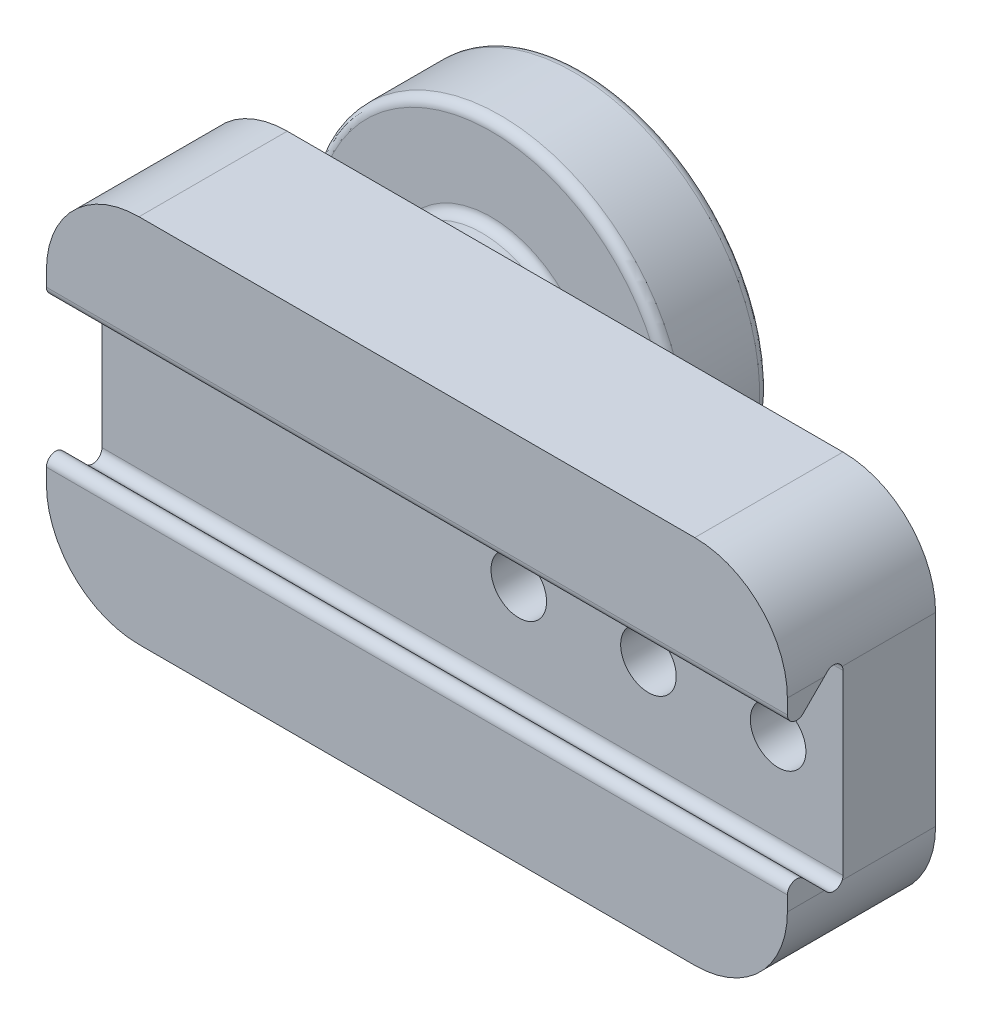
from build123d import *

# Parameters (mm, degrees)
BOSS_EXTRUDE1_DEPTH = 5
SKETCH2_R           = 5
BOSS_EXTRUDE2_DEPTH = 11
BOSS_EXTRUDE3_DEPTH = 8
CUT_EXTRUDE1_DEPTH  = 42
SKETCH6_R           = 1.5
CUT_EXTRUDE2_DEPTH  = 32
LPATTERN1_COUNT     = 3
LPATTERN1_PITCH     = 7
FILLET1_R           = 0.5
FILLET2_R           = 5
FILLET3_R           = 0.5


with BuildPart() as part:
    # Sketch1 → Boss-Extrude1 (new body)
    with BuildSketch(Plane.XY):
        with BuildLine():
            ThreePointArc((10, 0), (0, 10), (-10, 0))
            ThreePointArc((-10, 0), (0, -10), (10, 0))
        make_face()
    extrude(amount=BOSS_EXTRUDE1_DEPTH)

    # Sketch2 → Boss-Extrude2 (add)
    with BuildSketch(Plane.XY):
        with Locations(Location((0, 0, 0), (0, 0, 180))):
            Circle(SKETCH2_R)
    extrude(amount=BOSS_EXTRUDE2_DEPTH)

    # Sketch3 → Boss-Extrude3 (add)
    with BuildSketch(Plane.XY.offset(11)):
        Polygon((10, -10), (30, -10), (30, 10), (10, 10), (-10, 10), (-10, -10), align=None)
    extrude(amount=BOSS_EXTRUDE3_DEPTH)

    # Sketch5 → Cut-Extrude1 (cut)
    with BuildSketch(Plane(origin=(-10, 0, 0), x_dir=(0, 0, -1), z_dir=(1, 0, 0))):
        Polygon((-19, 3), (-16, 6), (-16, -6), (-19, -3), align=None)
    extrude(amount=CUT_EXTRUDE1_DEPTH, mode=Mode.SUBTRACT)

    # Sketch6 → Cut-Extrude2 (cut)
    with BuildSketch(Plane.XY):
        with Locations((26.5, 0)):
            Circle(SKETCH6_R)
    cut_extrude2 = extrude(amount=CUT_EXTRUDE2_DEPTH, mode=Mode.SUBTRACT)

    # LPattern1: Cut-Extrude2 ×3
    with Locations(*[(-i * LPATTERN1_PITCH, 0, 0) for i in range(1, LPATTERN1_COUNT)]):
        add(cut_extrude2, mode=Mode.SUBTRACT)

    # Fillet1
    fillet1_edges = [part.edges().sort_by_distance(p)[0] for p in [
        (10, 3, 19),
        (10, -3, 19),
        (10, -6, 16),
        (10, 6, 16),
    ]]
    fillet(fillet1_edges, radius=FILLET1_R)

    # Fillet2
    # the kernel refuses this fillet: 5 mm, written as the material it takes off along each edge
    with BuildSketch(Plane(origin=(-10, -10, -1.5), x_dir=(1, 0, 0), z_dir=(0, 0, 1)), Plane(origin=(30, -10, -1.5), x_dir=(0, 1, 0), z_dir=(0, 0, 1))) as fillet2_piece_1:
        with BuildLine():
            CenterArc((FILLET2_R, FILLET2_R), FILLET2_R, 180, 90)
            Line((0, FILLET2_R), (0, 0))
            Line((0, 0), (FILLET2_R, 0))
        make_face()
    extrude(amount=33, mode=Mode.SUBTRACT)
    with BuildSketch(Plane(origin=(30, 10, -1.5), x_dir=(0, -1, 0), z_dir=(0, 0, 1)), Plane(origin=(-10, 10, -1.5), x_dir=(1, 0, 0), z_dir=(0, 0, 1))) as fillet2_piece_2:
        with BuildLine():
            CenterArc((FILLET2_R, -FILLET2_R), FILLET2_R, 90, 90)
            Line((0, -FILLET2_R), (0, 0))
            Line((0, 0), (FILLET2_R, 0))
        make_face()
    extrude(amount=33, mode=Mode.SUBTRACT)

    # Fillet3
    fillet3_edges = [part.edges().sort_by_distance(p)[0] for p in [
        (5, 0, 11),
        (10, 0, 0),
        (10, 0, 5),
        (5, 0, 5),
    ]]
    fillet(fillet3_edges, radius=FILLET3_R)


solid = part.part
